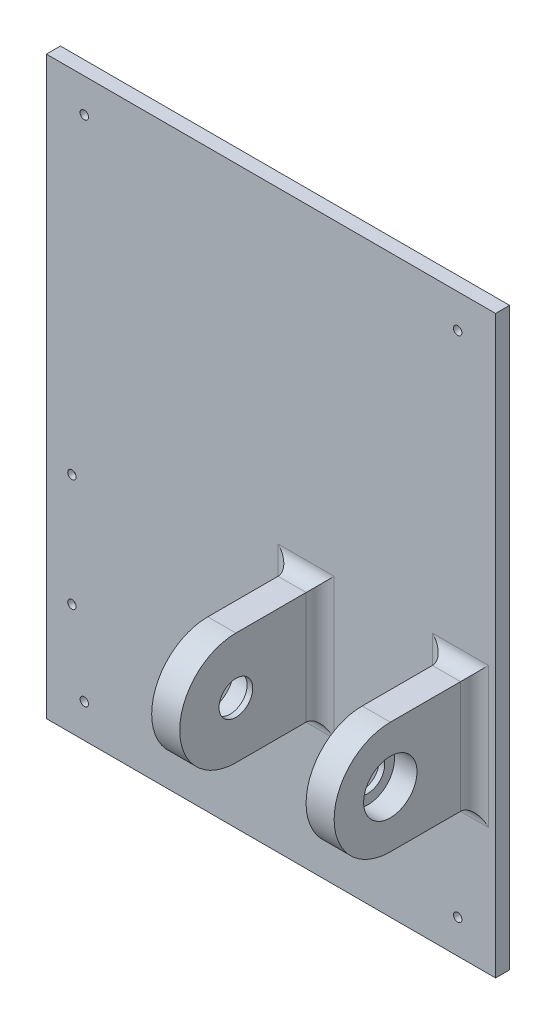
from build123d import *

# Parameters (mm, degrees)
SKETCH_2_W               = 160
SKETCH_2_H               = 205
EXTRUDE_1_DEPTH          = 5
SKETCH_3_W               = 10
SKETCH_3_H               = 40
EXTRUDE_2_DEPTH          = 35
SKETCH_4_R               = 20
EXTRUDE_3_DEPTH          = 10
SKETCH_5_R               = 9.5
CUT_EXTRUDE_1_DEPTH      = 8
SKETCH_13_R              = 6
CUT_EXTRUDE_2_DEPTH      = 168.676290055
FILLET_1_R               = 5
FILLET_1_OF_MIRROR_2_R   = 5
SKETCH_14_R              = 1.5
CUT_EXTRUDE_3_DEPTH      = 10
SKETCH_15_R              = 2.85
CUT_EXTRUDE_4_DEPTH      = 3
CUT_EXTRUDE_5_DEPTH      = 181.233427106
CUT_EXTRUDE_5_DEPTH_BACK = 181.233427106
SKETCH_18_R              = 1.5


with BuildPart() as part:
    # ｽｹｯﾁ2 → ﾎﾞｽ - 押し出し1 (new body)
    with BuildSketch(Plane.XY):
        with Locations((-40, 22.336245724)):
            Rectangle(SKETCH_2_W, SKETCH_2_H)
    extrude(amount=EXTRUDE_1_DEPTH)

    # ｽｹｯﾁ3 → ﾎﾞｽ - 押し出し2 (add)
    with BuildSketch(Plane.XY):
        with Locations((-27.5, -10)):
            Rectangle(SKETCH_3_W, SKETCH_3_H)
    extrude_2 = extrude(amount=EXTRUDE_2_DEPTH)

    # ｽｹｯﾁ4 → ﾎﾞｽ - 押し出し3 (add)
    with BuildSketch(Plane.ZY.offset(32.5)):
        with Locations((35, -10)):
            Circle(SKETCH_4_R)
    extrude_3 = extrude(amount=-EXTRUDE_3_DEPTH)

    # ｽｹｯﾁ5 → ｶｯﾄ - 押し出し1 (cut)
    with BuildSketch(Plane.ZY.offset(32.5)):
        with Locations((35, -10)):
            Circle(SKETCH_5_R)
    cut_extrude_1 = extrude(amount=-CUT_EXTRUDE_1_DEPTH, mode=Mode.SUBTRACT)

    # ｽｹｯﾁ13 → ｶｯﾄ - 押し出し2 (cut, through all)
    with BuildSketch(Plane(origin=(-22.5, 0, 0), x_dir=(0, 0, -1), z_dir=(1, 0, 0))):
        with Locations((-35, -10)):
            Circle(SKETCH_13_R)
    cut_extrude_2 = extrude(amount=-CUT_EXTRUDE_2_DEPTH, mode=Mode.SUBTRACT)

    # ﾌｨﾚｯﾄ1
    fillet_1_edges = [part.edges().sort_by_distance(p)[0] for p in [
        (-27.5, -30, 5),
        (-32.5, -10, 5),
        (-27.5, 10, 5),
        (-22.5, -10, 5),
    ]]
    fillet(fillet_1_edges, radius=FILLET_1_R)

    # ﾐﾗｰ2: ﾎﾞｽ - 押し出し2, ﾎﾞｽ - 押し出し3, ｶｯﾄ - 押し出し1, ｶｯﾄ - 押し出し2 across plane
    add(extrude_2.mirror(Plane(origin=(0, 0, 0), x_dir=(0, 0, 1), z_dir=(1, 0, 0))))
    add(extrude_3.mirror(Plane(origin=(0, 0, 0), x_dir=(0, 0, 1), z_dir=(1, 0, 0))))
    add(cut_extrude_1.mirror(Plane(origin=(0, 0, 0), x_dir=(0, 0, 1), z_dir=(1, 0, 0))), mode=Mode.SUBTRACT)
    add(cut_extrude_2.mirror(Plane(origin=(0, 0, 0), x_dir=(0, 0, 1), z_dir=(1, 0, 0))), mode=Mode.SUBTRACT)

    # ﾌｨﾚｯﾄ1 of ﾐﾗｰ2
    fillet_1_of_mirror_2_edges = [part.edges().sort_by_distance(p)[0] for p in [
        (27.5, -30, 5),
        (32.5, -10, 5),
        (27.5, 10, 5),
        (22.5, -10, 5),
    ]]
    fillet(fillet_1_of_mirror_2_edges, radius=FILLET_1_OF_MIRROR_2_R)

    # ｽｹｯﾁ14 → ｶｯﾄ - 押し出し3 (cut)
    with BuildSketch(Plane.XY):
        with Locations((-110.9, -0.35)):
            Circle(SKETCH_14_R)
        with Locations((-110.9, -40.35)):
            Circle(SKETCH_14_R)
    extrude(amount=CUT_EXTRUDE_3_DEPTH, mode=Mode.SUBTRACT)

    # ｽｹｯﾁ15 → ｶｯﾄ - 押し出し4 (cut)
    with BuildSketch(Plane.XY):
        with Locations((-110.9, -40.35)):
            Circle(SKETCH_15_R)
        Polygon((-113.75, -1.995448267), (-110.9, -3.640896534), (-108.05, -1.995448267), (-108.05, 1.295448267), (-110.9, 2.940896534), (-113.75, 1.295448267), align=None)
        Polygon((-113.75, -41.995448267), (-110.9, -43.640896534), (-108.05, -41.995448267), (-108.05, -38.704551733), (-110.9, -37.059103466), (-113.75, -38.704551733), align=None)
    extrude(amount=CUT_EXTRUDE_4_DEPTH, mode=Mode.SUBTRACT)

    # ｽｹｯﾁ18 → ｶｯﾄ - 押し出し5 (cut, two sides: drawn at the far end of the back side and taken through both)
    with BuildSketch(Plane.XY.offset(5).offset(-CUT_EXTRUDE_5_DEPTH_BACK)):
        with Locations((-106.5, 112.836245724)):
            Circle(SKETCH_18_R)
        with Locations((-106.5, -68.163754276)):
            Circle(SKETCH_18_R)
        with Locations((26.5, -68.163754276)):
            Circle(SKETCH_18_R)
        with Locations((26.5, 112.836245724)):
            Circle(SKETCH_18_R)
    extrude(amount=CUT_EXTRUDE_5_DEPTH + CUT_EXTRUDE_5_DEPTH_BACK, mode=Mode.SUBTRACT)


solid = part.part
